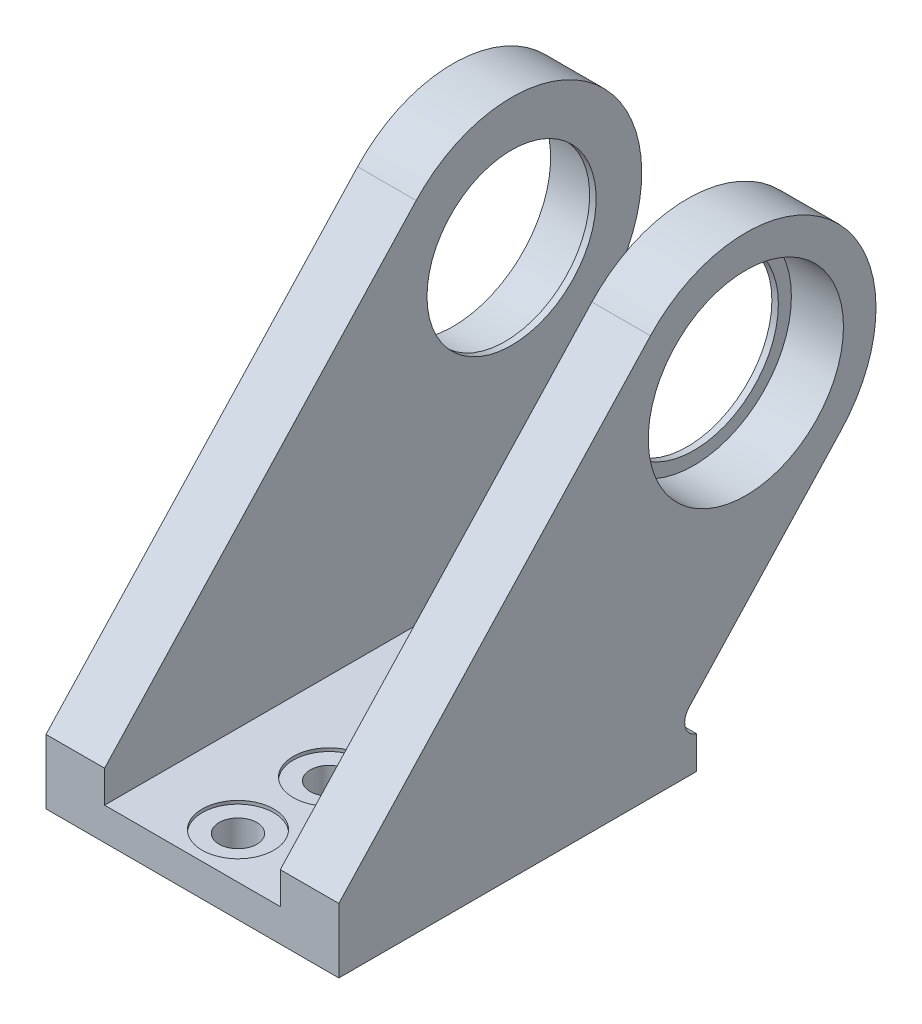
from build123d import *

# Parameters (mm, degrees)
SKETCH_1_W                  = 45
SKETCH_1_H                  = 50
EXTRUDE_1_DEPTH             = 5
EXTRUDE_2_DEPTH             = 9
EXTRUDE_START               = -9
EXTRUDE_3_DEPTH             = 9
SKETCH_4_R                  = 13
CUT_EXTRUDE_1_DEPTH         = 9
CUT_EXTRUDE_START           = -9
SKETCH_5_R                  = 13
CUT_EXTRUDE_2_DEPTH         = 9
SKETCH_6_W                  = 45
SKETCH_6_H                  = 5
EXTRUDE_4_DEPTH             = 5
FILLET_1_R                  = 2.5
HOLE_WIZARD_C_1_D           = 5.8
HOLE_WIZARD_C_1_DEPTH       = 5
HOLE_WIZARD_C_1_CBORE_D     = 11
HOLE_WIZARD_C_1_CBORE_DEPTH = 0.5
HOLE_WIZARD_C_1_TIP         = 1.742495795
SKETCH_15_R                 = 15
CUT_EXTRUDE_3_DEPTH         = 8
CUT_EXTRUDE_START_2         = -8
SKETCH_16_R                 = 15
CUT_EXTRUDE_4_DEPTH         = 8


with BuildPart() as part:
    # 草图1 → 凸台-拉伸1 (new body)
    with BuildSketch(Plane(origin=(0, 0, 0), x_dir=(1, 0, 0), z_dir=(0, 1, 0))):
        with Locations((22.5, 25)):
            Rectangle(SKETCH_1_W, SKETCH_1_H)
    extrude(amount=EXTRUDE_1_DEPTH)

    # 草图2 → 凸台-拉伸2 (add)
    with BuildSketch(Plane(origin=(45, 0, 0), x_dir=(0, 0, -1), z_dir=(1, 0, 0))):
        with BuildLine():
            Line((0, 5), (0, 9.920540101))
            Line((0, 9.920540101), (47.883739104, 61.528943381))
            ThreePointArc((47.883739104, 61.528943381), (76.148210795, 62.587073829), (77.206341243, 34.322602138))
            Line((77.206341243, 34.322602138), (50, 5))
            Line((50, 5), (0, 5))
        make_face()
    extrude(amount=-EXTRUDE_2_DEPTH)

    # 草图3 → 凸台-拉伸3 (add)
    with BuildSketch(Plane.ZY.offset(EXTRUDE_START)):
        with BuildLine():
            Line((-50, 5), (0, 5))
            Line((0, 5), (0, 9.920540101))
            Line((0, 9.920540101), (-47.883739104, 61.528943381))
            ThreePointArc((-47.883739104, 61.528943381), (-76.148210795, 62.587073829), (-77.206341243, 34.322602138))
            Line((-77.206341243, 34.322602138), (-50, 5))
        make_face()
    extrude(amount=EXTRUDE_3_DEPTH)

    # 草图4 → 切除-拉伸1 (cut)
    with BuildSketch(Plane.ZY):
        with Locations((-62.545040174, 47.92577276)):
            Circle(SKETCH_4_R)
    extrude(amount=-CUT_EXTRUDE_1_DEPTH, mode=Mode.SUBTRACT)

    # 草图5 → 切除-拉伸2 (cut)
    with BuildSketch(Plane(origin=(45, 0, 0), x_dir=(0, 0, -1), z_dir=(1, 0, 0)).offset(CUT_EXTRUDE_START)):
        with Locations(Location((62.545040174, 47.92577276, 0), (0, 0, 180))):
            Circle(SKETCH_5_R)
    extrude(amount=CUT_EXTRUDE_2_DEPTH, mode=Mode.SUBTRACT)

    # 草图6 → 凸台-拉伸4 (add)
    with BuildSketch(Plane(origin=(0, 0, -50), x_dir=(-1, 0, 0), z_dir=(0, 0, -1))):
        with Locations((-22.5, 2.5)):
            Rectangle(SKETCH_6_W, SKETCH_6_H)
    extrude(amount=EXTRUDE_4_DEPTH)

    # 圆角1
    # the kernel refuses this fillet: 2.5 mm, written as the material it adds along each edge
    with BuildSketch(Plane(origin=(9, 5, -50), x_dir=(0, 0, -1), z_dir=(-1, 0, 0))) as fillet_1_piece_1:
        with BuildLine():
            CenterArc((5.650108918, -2.413992211), FILLET_1_R, 105.072647289, 117.783385174)
            Line((3.817446285, -4.114388539), (3.780793032, -4.148396465))
            Line((3.780793032, -4.148396465), (-0.036653253, -0.034007927))
            Line((-0.036653253, -0.034007927), (0, 0.05))
            ThreePointArc((0, 0.05), (2.5, 0.05), (4.986997822, 0.048279844))
            Line((4.986997822, 0.048279844), (5, 0))
        make_face()
    extrude(amount=9)
    with BuildSketch(Plane(origin=(45, 5, -50), x_dir=(0, 0.7330650534621563, -0.6801585310738415), z_dir=(-1, 0, 0))) as fillet_1_piece_2:
        with BuildLine():
            CenterArc((5.612583111, 2.5), FILLET_1_R, 152.216614826, 117.783385174)
            Line((3.400792655, 3.665325267), (3.356556846, 3.688631773))
            ThreePointArc((3.356556846, 3.688631773), (1.663743075, 1.86667056), (-0.036653253, 0.034007927))
            Line((-0.036653253, 0.034007927), (0, -0.05))
            Line((0, -0.05), (5.612583111, -0.05))
            Line((5.612583111, -0.05), (5.612583111, 0))
        make_face()
    extrude(amount=9)

    # 打孔尺寸(%根据六角头螺)栓 C 级的类型1
    with Locations(Plane(origin=(22.5, 5, -21), x_dir=(0, 0, 1), z_dir=(0, 1, 0))):
        with Locations((0, 0), (14, 0), (-14, 0)):
            CounterBoreHole(HOLE_WIZARD_C_1_D / 2, HOLE_WIZARD_C_1_CBORE_D / 2, HOLE_WIZARD_C_1_CBORE_DEPTH, depth=HOLE_WIZARD_C_1_DEPTH)
            with Locations((0, 0, -(HOLE_WIZARD_C_1_DEPTH + HOLE_WIZARD_C_1_TIP / 2))):  # 118° drill point
                Cone(0, HOLE_WIZARD_C_1_D / 2, HOLE_WIZARD_C_1_TIP, mode=Mode.SUBTRACT)

    # 草图15 → 切除-拉伸3 (cut)
    with BuildSketch(Plane.ZY):
        with Locations((-62.545040174, 47.92577276)):
            Circle(SKETCH_15_R)
    extrude(amount=-CUT_EXTRUDE_3_DEPTH, mode=Mode.SUBTRACT)

    # 草图16 → 切除-拉伸4 (cut)
    with BuildSketch(Plane(origin=(45, 0, 0), x_dir=(0, 0, -1), z_dir=(1, 0, 0)).offset(CUT_EXTRUDE_START_2)):
        with Locations(Location((62.545040174, 47.92577276, 0), (0, 0, 180))):
            Circle(SKETCH_16_R)
    extrude(amount=CUT_EXTRUDE_4_DEPTH, mode=Mode.SUBTRACT)


solid = part.part
